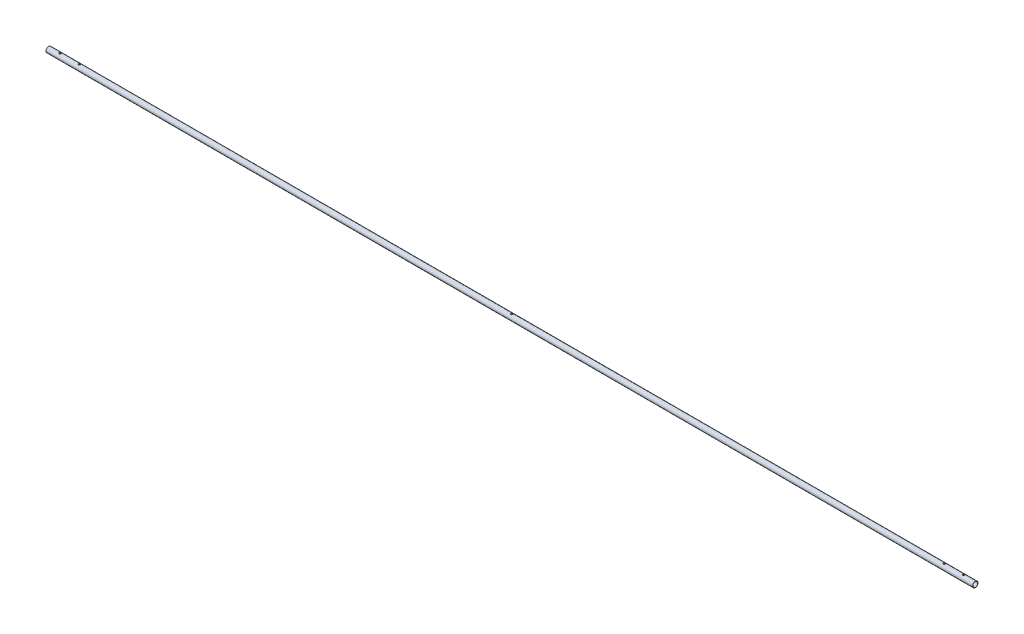
from build123d import *

# Parameters (mm, degrees)
SKETCH1_R               = 8.9662
SKETCH1_R_2             = 7.8994
BOSS_EXTRUDE1_DEPTH     = 3048
CUT_EXTRUDE2_DEPTH      = 3049.026375458
CUT_EXTRUDE2_DEPTH_BACK = 3049.026375458
SKETCH3_R               = 3.175
CUT_EXTRUDE5_DEPTH      = 3049.026375558
CUT_EXTRUDE5_DEPTH_BACK = 3049.026375558
SKETCH2_R               = 3.175


with BuildPart() as part:
    # Sketch1 → Boss-Extrude1 (new body)
    with BuildSketch(Plane(origin=(0, 0, 0), x_dir=(0, 0, -1), z_dir=(1, 0, 0))):
        Circle(SKETCH1_R)
        Circle(SKETCH1_R_2, mode=Mode.SUBTRACT)
    extrude(amount=BOSS_EXTRUDE1_DEPTH)

    # Sketch3 → Cut-Extrude2 (cut, two sides: drawn at the far end of the back side and taken through both)
    with BuildSketch(Plane(origin=(0, 0, 0), x_dir=(1, 0, 0), z_dir=(0, 1, 0)).offset(-CUT_EXTRUDE2_DEPTH_BACK)):
        with Locations((1524, 0)):
            Circle(SKETCH3_R)
    extrude(amount=CUT_EXTRUDE2_DEPTH + CUT_EXTRUDE2_DEPTH_BACK, mode=Mode.SUBTRACT)

    # Sketch2 → Cut-Extrude5 (cut, two sides: drawn at the far end of the back side and taken through both)
    with BuildSketch(Plane(origin=(0, 0, 0), x_dir=(1, 0, 0), z_dir=(0, 1, 0)).offset(-CUT_EXTRUDE5_DEPTH_BACK)):
        with Locations((38.1, 0)):
            Circle(SKETCH2_R)
        with Locations((3009.9, 0)):
            Circle(SKETCH2_R)
        with Locations((101.6, 0)):
            Circle(SKETCH2_R)
        with Locations((2946.4, 0)):
            Circle(SKETCH2_R)
    extrude(amount=CUT_EXTRUDE5_DEPTH + CUT_EXTRUDE5_DEPTH_BACK, mode=Mode.SUBTRACT)


solid = part.part
